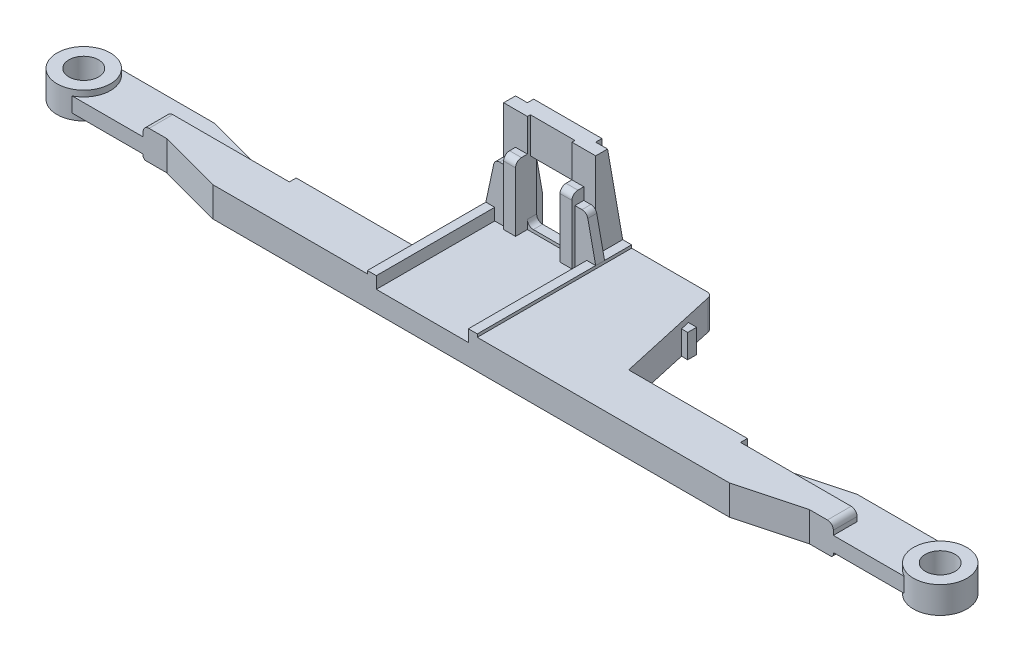
from build123d import *

# Parameters (mm, degrees)
SCHIZZO1_R                        = 2.5
ESTRUSIONE_ESTRUSIONE1_DEPTH      = 1.25
SCHIZZO2_R                        = 4.5
SCHIZZO2_R_2                      = 2.5
ESTRUSIONE_ESTRUSIONE2_DEPTH      = 2.25
ESTRUSIONE_ESTRUSIONE3_DEPTH      = 3
ESTRUSIONE_ESTRUSIONE3_DEPTH_BACK = 2
RACCORDO1_R                       = 1
RACCORDO2_R                       = 1
SCHIZZO8_W                        = 1.5
SCHIZZO8_H                        = 26
ESTRUSIONE_ESTRUSIONE4_DEPTH      = 0.5
SCHIZZO9_W                        = 1.5
SCHIZZO9_H                        = 26
ESTRUSIONE_ESTRUSIONE5_DEPTH      = 0.5
SCHIZZO10_W                       = 15.5
SCHIZZO10_H                       = 26
TAGLIO_ESTRUSIONE1_DEPTH          = 1.5
ESTRUSIONE_ESTRUSIONE6_DEPTH      = 2
ESTRUSIONE_ESTRUSIONE7_DEPTH      = 2
ESTRUSIONE_ESTRUSIONE8_DEPTH      = 11.5
SCHIZZO16_W                       = 7.5
SCHIZZO16_H                       = 6
TAGLIO_ESTRUSIONE2_DEPTH          = 0.5
TAGLIO_ESTRUSIONE3_DEPTH          = 82.579606421
SCHIZZO18_W                       = 2
SCHIZZO18_H                       = 11
ESTRUSIONE_ESTRUSIONE13_DEPTH     = 2
RACCORDO3_R                       = 1
RACCORDO3_OF_SPECCHIA3_R          = 1
ESTRUSIONE_ESTRUSIONE14_DEPTH     = 1.5
RACCORDO4_R                       = 1
RACCORDO4_OF_SPECCHIA4_R          = 1
RACCORDO5_R                       = 0.5
RACCORDO6_R                       = 0.5
SVUOTA1_START                     = -2
SVUOTA1_DEPTH                     = 4
SVUOTA1_2_DEPTH                   = 2.5
SVUOTA1_START_2                   = -0.25
SVUOTA1_3_DEPTH                   = 0.5
SVUOTA1_START_3                   = 2
SVUOTA1_4_OUTLINE_W               = 2
SVUOTA1_4_OUTLINE_H               = 1.057961884
SVUOTA1_4_DEPTH                   = 7.5
SVUOTA1_5_OUTLINE_W               = 1.5
SVUOTA1_5_OUTLINE_H               = 4.05674122
SVUOTA1_5_DEPTH                   = 0.5
SVUOTA1_START_4                   = -13
SVUOTA1_6_OUTLINE_W               = 4
SVUOTA1_6_OUTLINE_H               = 0.557961884
SVUOTA1_6_DEPTH                   = 9.5
SVUOTA1_START_5                   = -15
SVUOTA1_7_DEPTH                   = 2
SVUOTA1_START_6                   = -3.5
SVUOTA1_8_DEPTH                   = 2
SCHIZZO19_W                       = 11.5
SCHIZZO19_H                       = 2.998779336
TAGLIO_ESTRUSIONE4_DEPTH          = 83.581286238
ESTRUSIONE_ESTRUSIONE17_DEPTH     = 1.5
ESTRUSIONE_ESTRUSIONE19_REACH     = 83.077
SCHIZZO24_W                       = 2
SCHIZZO24_H                       = 2.5
SCHIZZO25_W                       = 2
SCHIZZO25_H                       = 4
ESTRUSIONE_ESTRUSIONE20_DEPTH     = 18.44325878
RACCORDO7_R                       = 1


# Read off the part's stored shape, not the designer's step: Svuota1
with BuildPart() as part:
    # Schizzo1 → Estrusione-Estrusione1 (new, symmetric)
    with BuildSketch(Plane(origin=(0, 0, 0), x_dir=(1, 0, 0), z_dir=(0, 1, 0))):
        with BuildLine():
            Line((43.5, 0), (-43.5, 0))
            Line((-43.5, 0), (-54.125184089, 2.847009496))
            Line((-54.125184089, 2.847009496), (-72.125184089, 2.847009496))
            ThreePointArc((-72.125184089, 2.847009496), (-76.125184089, 6.847009496), (-72.125184089, 10.847009496))
            Line((-72.125184089, 10.847009496), (-54.125184089, 10.847009496))
            Line((-54.125184089, 10.847009496), (-43.5, 8))
            Line((-43.5, 8), (43.5, 8))
            Line((43.5, 8), (54.125184089, 10.847009496))
            Line((54.125184089, 10.847009496), (72.125184089, 10.847009496))
            ThreePointArc((72.125184089, 10.847009496), (76.125184089, 6.847009496), (72.125184089, 2.847009496))
            Line((72.125184089, 2.847009496), (54.125184089, 2.847009496))
            Line((54.125184089, 2.847009496), (43.5, 0))
        make_face()
        with Locations(Location((-72.125184089, 6.847009496, 0), (0, 0, 270))):
            Circle(SCHIZZO1_R, mode=Mode.SUBTRACT)
        with Locations(Location((72.125184089, 6.847009496, 0), (0, 0, 270))):
            Circle(SCHIZZO1_R, mode=Mode.SUBTRACT)
    extrude(amount=ESTRUSIONE_ESTRUSIONE1_DEPTH, both=True)

    # Schizzo2 → Estrusione-Estrusione2 (add, symmetric)
    with BuildSketch(Plane(origin=(0, 0, 0), x_dir=(1, 0, 0), z_dir=(0, 1, 0))):
        with Locations(Location((-72.125184089, 6.847009496, 0), (0, 0, 270))):
            Circle(SCHIZZO2_R)
        with Locations(Location((-72.125184089, 6.847009496, 0), (0, 0, 270))):
            Circle(SCHIZZO2_R_2, mode=Mode.SUBTRACT)
    estrusione_estrusione2 = extrude(amount=ESTRUSIONE_ESTRUSIONE2_DEPTH, both=True)

    # Specchia1: Estrusione-Estrusione2 across plane
    add(estrusione_estrusione2.mirror(Plane(origin=(0, 0, 0), x_dir=(0, 0, 1), z_dir=(1, 0, 0))))

    # Schizzo7 → Estrusione-Estrusione3 (add, two sides: drawn at the far end of the back side and taken through both)
    with BuildSketch(Plane(origin=(0, 0, 0), x_dir=(1, 0, 0), z_dir=(0, 1, 0)).offset(-ESTRUSIONE_ESTRUSIONE3_DEPTH_BACK)):
        Polygon((-17.5, 8), (-17.5, 26), (14.5, 26), (18.5, 8), (38.5, 8), (38.5, 6.847009496), (58.125184089, 6.847009496), (58.125184089, 2.847009496), (54.125184089, 2.847009496), (43.5, 0), (-43.5, 0), (-54.125184089, 2.847009496), (-58.125184089, 2.847009496), (-58.125184089, 6.847009496), (-37.5, 6.847009496), (-37.5, 8), align=None)
    extrude(amount=ESTRUSIONE_ESTRUSIONE3_DEPTH + ESTRUSIONE_ESTRUSIONE3_DEPTH_BACK)

    # Raccordo1
    raccordo1_edges = [part.edges().sort_by_distance(p)[0] for p in [
        (-58.125184089, 3, -4.847009496),
    ]]
    fillet(raccordo1_edges, radius=RACCORDO1_R)

    # Raccordo2
    raccordo2_edges = [part.edges().sort_by_distance(p)[0] for p in [
        (58.125184089, 3, -4.847009496),
    ]]
    fillet(raccordo2_edges, radius=RACCORDO2_R)

    # Schizzo8 → Estrusione-Estrusione4 (add)
    with BuildSketch(Plane(origin=(0, 3, 0), x_dir=(1, 0, 0), z_dir=(0, 1, 0))):
        with Locations((-16.75, 13)):
            Rectangle(SCHIZZO8_W, SCHIZZO8_H)
    extrude(amount=ESTRUSIONE_ESTRUSIONE4_DEPTH)

    # Schizzo9 → Estrusione-Estrusione5 (add)
    with BuildSketch(Plane(origin=(0, 3, 0), x_dir=(1, 0, 0), z_dir=(0, 1, 0))):
        with Locations((0.25, 13)):
            Rectangle(SCHIZZO9_W, SCHIZZO9_H)
    extrude(amount=ESTRUSIONE_ESTRUSIONE5_DEPTH)

    # Schizzo10 → Taglio-Estrusione1 (cut)
    with BuildSketch(Plane(origin=(0, 3, 0), x_dir=(1, 0, 0), z_dir=(0, 1, 0))):
        with Locations((-8.25, 13)):
            Rectangle(SCHIZZO10_W, SCHIZZO10_H)
    extrude(amount=-TAGLIO_ESTRUSIONE1_DEPTH, mode=Mode.SUBTRACT)

    # Schizzo11 → Estrusione-Estrusione6 (add)
    with BuildSketch(Plane(origin=(-16, 0, 0), x_dir=(0, 0, -1), z_dir=(1, 0, 0))):
        Polygon((26, 1.5), (26, 3.5), (23.44325878, 18), (21.44325878, 18), (21.44325878, 1.5), align=None)
    extrude(amount=ESTRUSIONE_ESTRUSIONE6_DEPTH)

    # Schizzo12 → Estrusione-Estrusione7 (add)
    with BuildSketch(Plane.ZY.offset(0.5)):
        Polygon((-26, 1.5), (-26, 3.5), (-23.44325878, 18), (-21.44325878, 18), (-21.44325878, 1.5), align=None)
    extrude(amount=ESTRUSIONE_ESTRUSIONE7_DEPTH)

    # Schizzo15 → Estrusione-Estrusione8 (add)
    with BuildSketch(Plane.ZY.offset(2.5)):
        Polygon((-21.44325878, 1.5), (-23.001220664, 1.5), (-23.001220664, 12), (-24.501220664, 12), (-24.501220664, 18), (-23.44325878, 18), (-21.44325878, 18), align=None)
    extrude(amount=ESTRUSIONE_ESTRUSIONE8_DEPTH)

    # Schizzo16 → Taglio-Estrusione2 (cut)
    with BuildSketch(Plane.XY.offset(-21.44325878)):
        with Locations((-8.25, 15)):
            Rectangle(SCHIZZO16_W, SCHIZZO16_H)
    extrude(amount=-TAGLIO_ESTRUSIONE2_DEPTH, mode=Mode.SUBTRACT)

    # Schizzo17 → Taglio-Estrusione3 (cut, through all)
    with BuildSketch(Plane.XY.offset(-21.44325878)):
        with BuildLine():
            Line((-12, 12), (-4.5, 12))
            Line((-4.5, 12), (-4.5, 3))
            ThreePointArc((-4.5, 3), (-4.792893219, 2.292893219), (-5.5, 2))
            Line((-5.5, 2), (-11, 2))
            ThreePointArc((-11, 2), (-11.707106781, 2.292893219), (-12, 3))
            Line((-12, 3), (-12, 12))
        make_face()
    extrude(amount=-TAGLIO_ESTRUSIONE3_DEPTH, mode=Mode.SUBTRACT)

    # Schizzo18 → Estrusione-Estrusione13 (add)
    with BuildSketch(Plane.XY.offset(-21.44325878)):
        with Locations((-13, 7)):
            Rectangle(SCHIZZO18_W, SCHIZZO18_H)
    estrusione_estrusione13 = extrude(amount=ESTRUSIONE_ESTRUSIONE13_DEPTH)

    # Raccordo3
    raccordo3_edges = [part.edges().sort_by_distance(p)[0] for p in [
        (-13, 12.5, -19.44325878),
    ]]
    fillet(raccordo3_edges, radius=RACCORDO3_R)

    # Specchia3: Estrusione-Estrusione13 across plane
    add(estrusione_estrusione13.mirror(Plane(origin=(-8.25, 0, 0), x_dir=(0, 0, 1), z_dir=(1, 0, 0))))

    # Raccordo3 of Specchia3
    raccordo3_of_specchia3_edges = [part.edges().sort_by_distance(p)[0] for p in [
        (-3.5, 12.5, -19.44325878),
    ]]
    fillet(raccordo3_of_specchia3_edges, radius=RACCORDO3_OF_SPECCHIA3_R)

    # Schizzo3D2 → Estrusione-Estrusione14 (add)
    with BuildSketch(Plane(origin=(-14, 10.5, -21.44325878), x_dir=(-0.2169304578186563, -0.9761870601839527, 0), z_dir=(0, 0, 1))):
        Polygon((0, 0), (0.433860916, -1.95237412), (7.592566024, -1.898141506), (7.267170337, -0.433860916), (9.219544457, 0), (8.785683542, 1.95237412), align=None)
    estrusione_estrusione14 = extrude(amount=ESTRUSIONE_ESTRUSIONE14_DEPTH)

    # Raccordo4
    # the kernel refuses this fillet: 1 mm, written as the material it takes off along each edge
    with BuildSketch(Plane(origin=(-16, 10.5, -21.44325878), x_dir=(1, 0, 0), z_dir=(0, 0, 1))) as raccordo4_piece_1:
        with BuildLine():
            CenterArc((RACCORDO4_R * 0.808415790234, -RACCORDO4_R), RACCORDO4_R, 90, 77.905242923)
            Line((-RACCORDO4_R * 0.169386623843, -RACCORDO4_R * 0.790470911269), (0, 0))
            Line((0, 0), (RACCORDO4_R * 0.808415790234, 0))
        make_face()
    extrude(amount=3.521039476, mode=Mode.SUBTRACT)

    # Specchia4: Estrusione-Estrusione14 across plane
    add(estrusione_estrusione14.mirror(Plane(origin=(-8.25, 0, 0), x_dir=(0, 0, 1), z_dir=(1, 0, 0))))

    # Raccordo4 of Specchia4
    # the kernel refuses this fillet: 1 mm, written as the material it takes off along each edge
    with BuildSketch(Plane(origin=(-0.5, 10.5, -21.44325878), x_dir=(-1, 0, 0), z_dir=(0, 0, 1))) as raccordo4_of_specchia4_piece_1:
        with BuildLine():
            CenterArc((RACCORDO4_OF_SPECCHIA4_R * 0.808415790234, RACCORDO4_OF_SPECCHIA4_R), RACCORDO4_OF_SPECCHIA4_R, 192.094757077, 77.905242923)
            Line((-RACCORDO4_OF_SPECCHIA4_R * 0.169386623843, RACCORDO4_OF_SPECCHIA4_R * 0.790470911269), (0, 0))
            Line((0, 0), (RACCORDO4_OF_SPECCHIA4_R * 0.808415790234, 0))
        make_face()
    extrude(amount=3.521039476, mode=Mode.SUBTRACT)

    # Raccordo5
    raccordo5_edges = [part.edges().sort_by_distance(p)[0] for p in [
        (58.125184089, -2, -4.847009496),
    ]]
    fillet(raccordo5_edges, radius=RACCORDO5_R)

    # Raccordo6
    raccordo6_edges = [part.edges().sort_by_distance(p)[0] for p in [
        (-58.125184089, -2, -4.847009496),
    ]]
    fillet(raccordo6_edges, radius=RACCORDO6_R)

    # Svuota1 outline → Svuota1 (cut)
    with BuildSketch(Plane(origin=(0, 0, 0), x_dir=(1, 0, 0), z_dir=(0, 1, 0)).offset(SVUOTA1_START)):
        Polygon((-3.5, 20.94325878), (0.5, 20.94325878), (0.5, 1), (43.368347502, 1), (53.993531592, 3.847009496), (57.125184089, 3.847009496), (57.125184089, 5.847009496), (37.5, 5.847009496), (37.5, 7), (17.697828394, 7), (13.697828394, 25), (-1.5, 25), (-1.5, 22.001220664), (-3.5, 22.001220664), align=None)
        Polygon((-15, 22.001220664), (-15, 25), (-16.5, 25), (-16.5, 20.94325878), (-13, 20.94325878), (-13, 22.001220664), align=None)
        Polygon((-43.368347502, 1), (-17, 1), (-17, 7), (-36.5, 7), (-36.5, 5.847009496), (-57.125184089, 5.847009496), (-57.125184089, 3.847009496), (-53.993531592, 3.847009496), align=None)
    extrude(amount=SVUOTA1_DEPTH, mode=Mode.SUBTRACT)

    # Svuota1 2 outline → Svuota1 2 (cut)
    with BuildSketch(Plane(origin=(0, 0, 0), x_dir=(1, 0, 0), z_dir=(0, 1, 0)).offset(SVUOTA1_START)):
        Polygon((0.5, 20.94325878), (-3.5, 20.94325878), (-3.5, 22.001220664), (-1.5, 22.001220664), (-1.5, 25), (-15, 25), (-15, 22.001220664), (-13, 22.001220664), (-13, 20.94325878), (-16.5, 20.94325878), (-16.5, 7), (-17, 7), (-17, 1), (0.5, 1), align=None)
    extrude(amount=SVUOTA1_2_DEPTH, mode=Mode.SUBTRACT)

    # Svuota1 3 outline → Svuota1 3 (cut)
    with BuildSketch(Plane(origin=(0, 0, 0), x_dir=(1, 0, 0), z_dir=(0, 1, 0)).offset(SVUOTA1_START_2)):
        with BuildLine():
            Line((43.631652498, 7), (37.5, 7))
            Line((37.5, 7), (37.5, 5.847009496))
            Line((37.5, 5.847009496), (57.125184089, 5.847009496))
            Line((57.125184089, 5.847009496), (57.125184089, 3.847009496))
            Line((57.125184089, 3.847009496), (70.322408451, 3.847009496))
            ThreePointArc((70.322408451, 3.847009496), (68.625184089, 6.847009496), (70.322408451, 9.847009496))
            Line((70.322408451, 9.847009496), (54.256836587, 9.847009496))
            Line((54.256836587, 9.847009496), (43.631652498, 7))
        make_face()
        with BuildLine():
            Line((-36.5, 5.847009496), (-36.5, 7))
            Line((-36.5, 7), (-43.631652498, 7))
            Line((-43.631652498, 7), (-54.256836587, 9.847009496))
            Line((-54.256836587, 9.847009496), (-70.322408451, 9.847009496))
            ThreePointArc((-70.322408451, 9.847009496), (-68.625184089, 6.847009496), (-70.322408451, 3.847009496))
            Line((-70.322408451, 3.847009496), (-57.125184089, 3.847009496))
            Line((-57.125184089, 3.847009496), (-57.125184089, 5.847009496))
            Line((-57.125184089, 5.847009496), (-36.5, 5.847009496))
        make_face()
    extrude(amount=SVUOTA1_3_DEPTH, mode=Mode.SUBTRACT)

    # Svuota1 4 outline → Svuota1 4 (cut)
    with BuildSketch(Plane(origin=(0, 0, 0), x_dir=(1, 0, 0), z_dir=(0, 1, 0)).offset(SVUOTA1_START_3)):
        with Locations((-2.5, 21.472239722)):
            Rectangle(SVUOTA1_4_OUTLINE_W, SVUOTA1_4_OUTLINE_H)
        with Locations((-14, 21.472239722)):
            Rectangle(SVUOTA1_4_OUTLINE_W, SVUOTA1_4_OUTLINE_H)
    extrude(amount=SVUOTA1_4_DEPTH, mode=Mode.SUBTRACT)

    # Svuota1 5 outline → Svuota1 5 (cut)
    with BuildSketch(Plane(origin=(0, 0, 0), x_dir=(1, 0, 0), z_dir=(0, 1, 0)).offset(SVUOTA1_START_3)):
        with Locations((-0.75, 22.97162939)):
            Rectangle(SVUOTA1_5_OUTLINE_W, SVUOTA1_5_OUTLINE_H)
        with Locations((-15.75, 22.97162939)):
            Rectangle(SVUOTA1_5_OUTLINE_W, SVUOTA1_5_OUTLINE_H)
    extrude(amount=SVUOTA1_5_DEPTH, mode=Mode.SUBTRACT)

    # Svuota1 6 outline → Svuota1 6 (cut)
    with BuildSketch(Plane.YZ.offset(SVUOTA1_START_4)):
        with Locations((15, -23.222239722)):
            Rectangle(SVUOTA1_6_OUTLINE_W, SVUOTA1_6_OUTLINE_H)
    extrude(amount=SVUOTA1_6_DEPTH, mode=Mode.SUBTRACT)

    # Svuota1 7 outline → Svuota1 7 (cut)
    with BuildSketch(Plane.YZ.offset(SVUOTA1_START_5)):
        Polygon((17, -22.604159149), (17, -22.44325878), (13, -22.44325878), (13, -23.309467071), align=None)
    extrude(amount=SVUOTA1_7_DEPTH, mode=Mode.SUBTRACT)

    # Svuota1 8 outline → Svuota1 8 (cut)
    with BuildSketch(Plane.YZ.offset(SVUOTA1_START_6)):
        Polygon((17, -22.604159149), (17, -22.44325878), (13, -22.44325878), (13, -23.309467071), align=None)
    extrude(amount=SVUOTA1_8_DEPTH, mode=Mode.SUBTRACT)

    # Schizzo19 → Taglio-Estrusione4 (cut, through all)
    with BuildSketch(Plane(origin=(0, 1.5, 0), x_dir=(1, 0, 0), z_dir=(0, 1, 0))):
        with Locations((-8.25, 24.500610332)):
            Rectangle(SCHIZZO19_W, SCHIZZO19_H)
    extrude(amount=-TAGLIO_ESTRUSIONE4_DEPTH, mode=Mode.SUBTRACT)

    # Schizzo20 → Estrusione-Estrusione17 (add)
    with BuildSketch(Plane(origin=(0, 0, -20.94325878), x_dir=(-1, 0, 0), z_dir=(0, 0, 1))):
        Polygon((16.5, -0.5), (16.5, 2), (8.5, 2), (8.5, 5), (2, 5), (2, 9), (-5, 9), (-5, 5), (-11, 5), (-11, 2), (-17, 2), (-17, -2), (-0.5, -2), (-0.5, -0.5), align=None)
    extrude(amount=ESTRUSIONE_ESTRUSIONE17_DEPTH)

    # Schizzo24 → Estrusione-Estrusione19 (add, up to next)
    with BuildSketch(Plane.XY.offset(-19.44325878), mode=Mode.PRIVATE) as estrusione_estrusione19_sk1:
        with Locations((-7.5, -0.75)):
            Rectangle(SCHIZZO24_W, SCHIZZO24_H)
    estrusione_estrusione19_tool1 = extrude(estrusione_estrusione19_sk1.sketch, amount=ESTRUSIONE_ESTRUSIONE19_REACH, mode=Mode.PRIVATE) - part.part
    add(estrusione_estrusione19_tool1.solids().sort_by_distance((-7.5, -0.75, -19.443259))[0])

    # Schizzo25 → Estrusione-Estrusione20 (add)
    with BuildSketch(Plane.XY.offset(-19.44325878)):
        with Locations((10, 0)):
            Rectangle(SCHIZZO25_W, SCHIZZO25_H)
    extrude(amount=ESTRUSIONE_ESTRUSIONE20_DEPTH)

    # Raccordo7
    raccordo7_edges = [part.edges().sort_by_distance(p)[0] for p in [
        (14.5, 0.5, -26),
    ]]
    fillet(raccordo7_edges, radius=RACCORDO7_R)


solid = part.part
